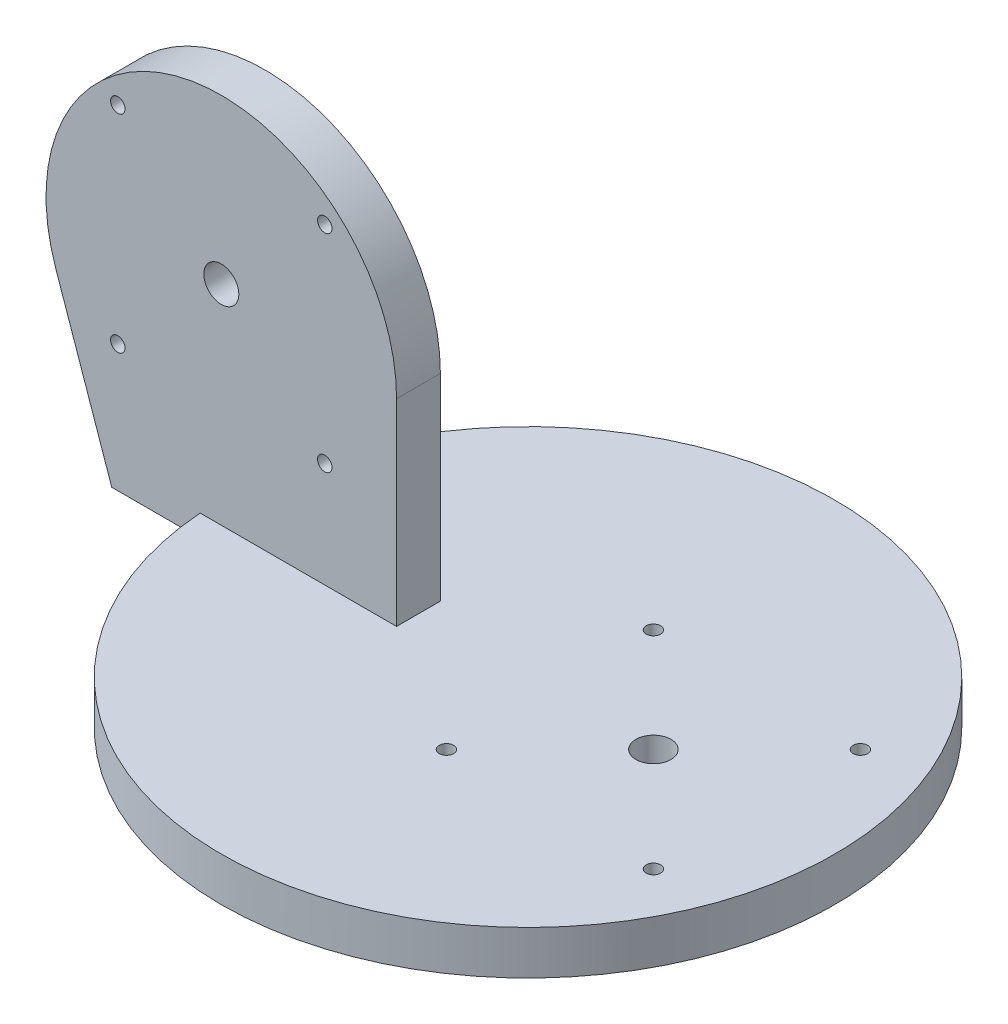
from build123d import *

# Parameters (mm, degrees)
SKETCH1_R                 = 70
BOSS_EXTRUDE1_DEPTH       = 10
BOSS_EXTRUDE2_START       = -3
BOSS_EXTRUDE2_OUTLINE_R   = 65
BOSS_EXTRUDE2_DEPTH       = 3
BOSS_EXTRUDE3_DEPTH       = 5
M4X0_7_TAPPED_HOLE1_D     = 3.3
M4X0_7_TAPPED_HOLE1_DEPTH = 10.1
M4X0_7_TAPPED_HOLE1_TIP   = 0.991420021
F_8_0MM_DOWEL_HOLE1_D     = 8
F_8_0MM_DOWEL_HOLE2_D     = 8
M4X0_7_TAPPED_HOLE2_D     = 3.3
M4X0_7_TAPPED_HOLE2_DEPTH = 10.1
M4X0_7_TAPPED_HOLE2_TIP   = 0.991420021


# Read off the part's stored shape, not the designer's step: Boss-Extrude2
with BuildPart() as part:
    # Sketch1 → Boss-Extrude1 (new body)
    with BuildSketch(Plane(origin=(0, 0, 0), x_dir=(1, 0, 0), z_dir=(0, 1, 0))):
        with Locations(Location((0, 0, 0), (0, 0, 270))):
            Circle(SKETCH1_R)
    extrude(amount=BOSS_EXTRUDE1_DEPTH)

    # Boss-Extrude2 outline → Boss-Extrude2 (add)
    with BuildSketch(Plane(origin=(0, 0, 0), x_dir=(1, 0, 0), z_dir=(0, 1, 0)).offset(BOSS_EXTRUDE2_START)):
        Circle(BOSS_EXTRUDE2_OUTLINE_R)
    extrude(amount=BOSS_EXTRUDE2_DEPTH)

    # Sketch3 → Boss-Extrude3 (add, symmetric)
    with BuildSketch(Plane.XY):
        with BuildLine():
            Line((-25, 55), (-25, 5))
            Line((-25, 5), (-90, 5))
            Line((-90, 5), (-102.792798963, 41.896399481))
            ThreePointArc((-102.792798963, 41.896399481), (-71.644096684, 94.444340269), (-25, 55))
        make_face()
    extrude(amount=BOSS_EXTRUDE3_DEPTH, both=True)

    # M4x0.7 Tapped Hole1
    with Locations(Plane(origin=(0, 10, 0), x_dir=(1, 0, 0), z_dir=(0, 1, 0))):
        with Locations((5, 23.62), (52.24, 23.62), (52.24, -23.62), (5, -23.62)):
            Hole(M4X0_7_TAPPED_HOLE1_D / 2, depth=M4X0_7_TAPPED_HOLE1_DEPTH)
            with Locations((0, 0, -(M4X0_7_TAPPED_HOLE1_DEPTH + M4X0_7_TAPPED_HOLE1_TIP / 2))):  # 118° drill point
                Cone(0, M4X0_7_TAPPED_HOLE1_D / 2, M4X0_7_TAPPED_HOLE1_TIP, mode=Mode.SUBTRACT)

    # Ø8.0mm Dowel Hole1 (through all)
    with Locations(Plane(origin=(0, 10, 0), x_dir=(1, 0, 0), z_dir=(0, 1, 0))):
        with Locations((28.62, 0)):
            Hole(F_8_0MM_DOWEL_HOLE1_D / 2)

    # Ø8.0mm Dowel Hole2 (through all)
    with Locations(Plane.XY.offset(5)):
        with Locations((-65, 57.639293091)):
            Hole(F_8_0MM_DOWEL_HOLE2_D / 2)

    # M4x0.7 Tapped Hole2
    with Locations(Plane(origin=(-106.523745818, 66.238796536, 5), x_dir=(1, 0, 0), z_dir=(0, 0, 1))):
        with Locations((17.903745818, 15.020496555), (65.143745818, 15.020496555), (65.143745818, -32.219503445), (17.903745818, -32.219503445)):
            Hole(M4X0_7_TAPPED_HOLE2_D / 2, depth=M4X0_7_TAPPED_HOLE2_DEPTH)
            with Locations((0, 0, -(M4X0_7_TAPPED_HOLE2_DEPTH + M4X0_7_TAPPED_HOLE2_TIP / 2))):  # 118° drill point
                Cone(0, M4X0_7_TAPPED_HOLE2_D / 2, M4X0_7_TAPPED_HOLE2_TIP, mode=Mode.SUBTRACT)


solid = part.part
